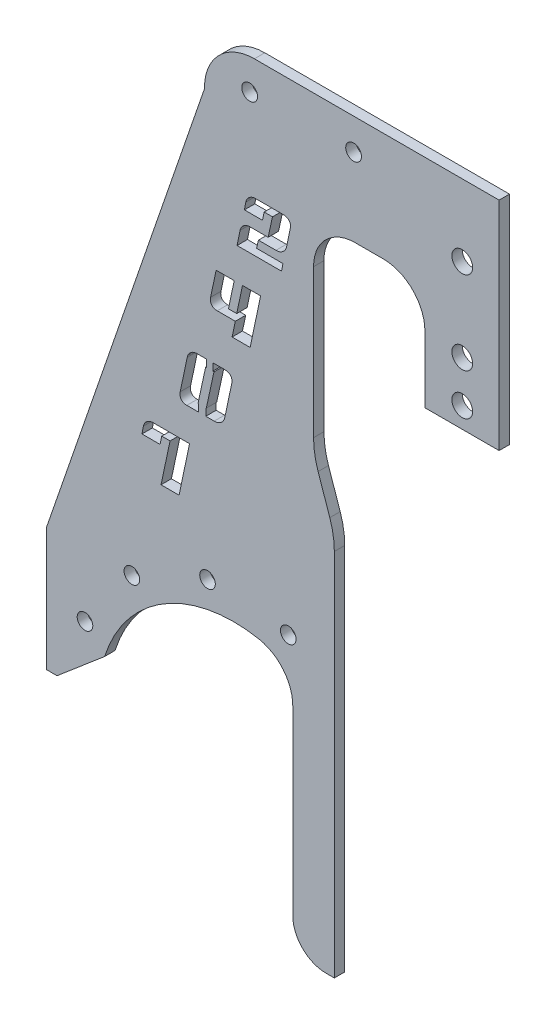
from build123d import *

# Parameters (mm, degrees)
BOSS_EXTRUDE1_DEPTH  = 6.35
FILLET1_R            = 8.255
SKETCH2_R            = 3.175
CUT_EXTRUDE1_DEPTH   = 128.158650905
CHAMFER2_START       = -126.7457463
CHAMFER2_OUTLINE_W   = 36
CHAMFER2_OUTLINE_H   = 6.35
CHAMFER2_DEPTH       = 83.771913248
FILLET4_R            = 20.955
FILLET5_R            = 12.7
SKETCH3_W            = 25.4
SKETCH3_H            = 25.4
SKETCH3_R            = 3.175
BOSS_EXTRUDE2_DEPTH  = 6.35
SKETCH4_W            = 25.4
SKETCH4_H            = 177.8
SKETCH4_R            = 3.175
BOSS_EXTRUDE3_DEPTH  = 6.35
SKETCH5_W            = 25.4
SKETCH5_H            = 101.6
CUT_EXTRUDE2_DEPTH   = 144.824345992
CHAMFER3_DEPTH       = 6.35
FILLET7_R            = 22.86
SKETCH6_R            = 2.38125
CUT_EXTRUDE3_DEPTH   = 144.824345992
BOSS_EXTRUDE4_DEPTH  = 6.35
SKETCH8_W            = 135.766472114
SKETCH8_H            = 151.024358954
CUT_EXTRUDE4_DEPTH   = 144.824345992
CHAMFER4_SIZE        = 48.26
CHAMFER4_SIZE2       = 140.157216957
FILLET8_R            = 12.7
SKETCH9_W            = 6.35
SKETCH9_H            = 40.340536446
BOSS_EXTRUDE5_DEPTH  = 6.35
FILLET9_R            = 12.7
FILLET10_R           = 12.7
SKETCH10_W           = 12.7
SKETCH10_H           = 17.865875077
CUT_EXTRUDE5_DEPTH   = 144.824345992
CUT_EXTRUDE6_DEPTH   = 144.824345992
FILLET11_R           = 12.7
CUT_EXTRUDE7_DEPTH   = 144.824345992
SKETCH13_W           = 91.44
SKETCH13_H           = 15.550301769
BOSS_EXTRUDE6_DEPTH  = 6.35
FILLET12_R           = 15.24
SKETCH14_W           = 6.35
SKETCH14_H           = 101.6
BOSS_EXTRUDE7_DEPTH  = 6.35
CHAMFER5_SIZE        = 7.62
CHAMFER5_SIZE_2      = 22.130086888
FILLET13_R           = 25.4
FILLET14_R           = 12.7
CUT_EXTRUDE8_DEPTH   = 156.200115028
SKETCH16_W           = 1.995675916
SKETCH16_H           = 3.389683485
SKETCH16_W_2         = 2.247396164
SKETCH16_H_2         = 3.571492208
BOSS_EXTRUDE9_DEPTH  = 6.35
SKETCH18_W           = 15.365544209
SKETCH18_H           = 72.075093694
SKETCH18_W_2         = 16.922999919
SKETCH18_H_2         = 33.02
CUT_EXTRUDE9_DEPTH   = 156.200115173
FILLET15_R           = 12.7
SKETCH19_W           = 12.7
SKETCH19_H           = 50.8
BOSS_EXTRUDE10_DEPTH = 6.35
FILLET16_R           = 10.16
SKETCH20_R           = 244.077195531
CUT_EXTRUDE10_DEPTH  = 3.175
SKETCH21_R           = 2.413
CUT_EXTRUDE11_DEPTH  = 156.102655922


with BuildPart() as part:
    # Sketch1 → Boss-Extrude1 (new body)
    with BuildSketch(Plane.XY):
        with BuildLine():
            Line((12.7, 76.2), (-12.7, 76.2))
            Line((-12.7, 76.2), (-12.7, -28.680951188))
            ThreePointArc((-12.7, -28.680951188), (-71.390768363, -25.798437524), (-101.6, -76.2))
            Line((-101.6, -76.2), (-85.725, -76.2))
            ThreePointArc((-85.725, -76.2), (-58.470420375, -37.379213847), (-12.7, -49.826469235))
            Line((-12.7, -49.826469235), (-12.7, -76.2))
            Line((-12.7, -76.2), (12.7, -76.2))
            Line((12.7, -76.2), (12.7, 76.2))
        make_face()
    extrude(amount=BOSS_EXTRUDE1_DEPTH)

    # Fillet1
    fillet1_edges = [part.edges().sort_by_distance(p)[0] for p in [
        (-12.7, -49.826469235, 3.175),
    ]]
    fillet(fillet1_edges, radius=FILLET1_R)

    # Chamfer1
    # the kernel refuses this chamfer: 16.925734726, 15.24 mm, written as the material it takes off along each edge
    with BuildSketch(Plane(origin=(-85.725, -76.2, -32.922584323), x_dir=(0.15149402541241913, 0.9884581732498049, 0), z_dir=(0, 0, 1))) as chamfer1_piece_1:
        with BuildLine():
            Line((13.017434015, -0.44343203), (-2.4273823, 12.943386903))
            Line((-2.4273823, 12.943386903), (-2.761989917, 12.89210395))
            ThreePointArc((-2.761989917, 12.89210395), (-1.331569383, 6.453627085), (-0.334607617, -0.051282954))
            Line((-0.334607617, -0.051282954), (0.051282954, -0.334607617))
            ThreePointArc((0.051282954, -0.334607617), (6.510978775, 0.137060785), (12.966151061, -0.778039646))
            Line((12.966151061, -0.778039646), (13.017434015, -0.44343203))
        make_face()
    extrude(amount=72.195168646, mode=Mode.SUBTRACT)

    # Sketch2 → Cut-Extrude1 (cut, through all)
    with BuildSketch(Plane.XY.offset(6.35)):
        with Locations((0, 57.15)):
            Circle(SKETCH2_R)
        with Locations((0, 69.85)):
            Circle(SKETCH2_R)
    extrude(amount=-CUT_EXTRUDE1_DEPTH, mode=Mode.SUBTRACT)

    # Chamfer2: read off the stored shape, not the designer's step
    # Chamfer2 outline → Chamfer2 (cut)
    with BuildSketch(Plane(origin=(0, 0, 0), x_dir=(0.6493951635681026, -0.7604511302735748, 0), z_dir=(0.7604511302735747, 0.6493951635681027, 0)).offset(CHAMFER2_START)):
        with Locations((47, -3.175)):
            Rectangle(CHAMFER2_OUTLINE_W, CHAMFER2_OUTLINE_H)
    extrude(amount=CHAMFER2_DEPTH, mode=Mode.SUBTRACT)

    # Fillet4
    # the kernel refuses this fillet: 20.955 mm, written as the material it takes off along each edge
    with BuildSketch(Plane(origin=(8.560811014, -76.2, 27.244649936), x_dir=(1, 0, 0), z_dir=(0, 0, -1))) as fillet4_piece_1:
        with BuildLine():
            CenterArc((10.50769959, -19.963819717), FILLET4_R, 107.692818626, 31.811166067)
            Line((-5.427553845, -6.355744064), (-5.746258914, -6.083582551))
            Line((-5.746258914, -6.083582551), (-0.318705069, 0.272161513))
            Line((-0.318705069, 0.272161513), (0, 0.4191))
            ThreePointArc((0, 0.4191), (2.069594493, 0.4191), (4.011818774, 0.399276394))
            Line((4.011818774, 0.399276394), (4.139188986, 0))
        make_face()
    extrude(amount=48.139299873, mode=Mode.SUBTRACT)

    # Fillet5
    fillet5_edges = [part.edges().sort_by_distance(p)[0] for p in [
        (-12.7, -28.680951188, 3.175),
    ]]
    fillet(fillet5_edges, radius=FILLET5_R)

    # Sketch3 → Boss-Extrude2 (add)
    with BuildSketch(Plane.XY.offset(6.35)):
        with Locations((0, 88.9)):
            Rectangle(SKETCH3_W, SKETCH3_H)
        with Locations((0, 95.25)):
            Circle(SKETCH3_R, mode=Mode.SUBTRACT)
    extrude(amount=-BOSS_EXTRUDE2_DEPTH)

    # Sketch4 → Boss-Extrude3 (add)
    with BuildSketch(Plane(origin=(0, 0, 0), x_dir=(-1, 0, 0), z_dir=(0, 0, -1))):
        with Locations((-25.4, 12.7)):
            Rectangle(SKETCH4_W, SKETCH4_H)
        with Locations((-25.4, 95.25)):
            Circle(SKETCH4_R, mode=Mode.SUBTRACT)
        with Locations((-25.4, 69.85)):
            Circle(SKETCH4_R, mode=Mode.SUBTRACT)
        with Locations((-25.4, 57.15)):
            Circle(SKETCH4_R, mode=Mode.SUBTRACT)
    extrude(amount=-BOSS_EXTRUDE3_DEPTH)

    # Sketch5 → Cut-Extrude2 (cut, through all)
    with BuildSketch(Plane(origin=(0, 0, 0), x_dir=(-1, 0, 0), z_dir=(0, 0, -1))):
        with Locations((0, 50.8)):
            Rectangle(SKETCH5_W, SKETCH5_H)
    extrude(amount=-CUT_EXTRUDE2_DEPTH, mode=Mode.SUBTRACT)

    # Chamfer3: read off the stored shape, not the designer's step
    # Chamfer3 outline → Chamfer3 (cut)
    with BuildSketch(Plane.XY):
        with BuildLine():
            ThreePointArc((-12.7, -8.997916699), (-13.235467867, -12.646773779), (-14.796717794, -15.98793862))
            Line((-14.796717794, -15.98793862), (12.7, -1.180669249))
            Line((12.7, -1.180669249), (12.7, 0))
            Line((12.7, 0), (-12.7, 0))
            Line((-12.7, 0), (-12.7, -8.997916699))
        make_face()
    extrude(amount=CHAMFER3_DEPTH, mode=Mode.SUBTRACT)

    # Fillet7
    fillet7_edges = [part.edges().sort_by_distance(p)[0] for p in [
        (-14.796717794, -15.98793862, 3.175),
        (12.7, -1.180669249, 3.175),
    ]]
    fillet(fillet7_edges, radius=FILLET7_R)

    # Sketch6 → Cut-Extrude3 (cut, through all)
    with BuildSketch(Plane(origin=(0, 0, 0), x_dir=(-1, 0, 0), z_dir=(0, 0, -1))):
        with Locations((89.842397197, -57.554736727)):
            Circle(SKETCH6_R)
        with Locations((75.517874882, -38.214440689)):
            Circle(SKETCH6_R)
        with Locations((52.406792333, -27.776813182)):
            Circle(SKETCH6_R)
        with Locations((27.741530006, -30.059534069)):
            Circle(SKETCH6_R)
    extrude(amount=-CUT_EXTRUDE3_DEPTH, mode=Mode.SUBTRACT)

    # Sketch7 → Boss-Extrude4 (add)
    with BuildSketch(Plane(origin=(0, 0, 0), x_dir=(-1, 0, 0), z_dir=(0, 0, -1))):
        with BuildLine():
            Line((-12.7, 101.6), (-12.7, 50.876119176))
            Line((-12.7, 50.876119176), (20.01821952, 50.876119176))
            Line((20.01821952, 50.876119176), (20.01821952, -20.501239648))
            ThreePointArc((20.01821952, -20.501239648), (24.376422726, -21.656601053), (28.863636364, -21.216477299))
            ThreePointArc((28.863636364, -21.216477299), (78.912746685, -30.610071387), (101.6, -76.2))
            Line((101.6, -76.2), (101.6, 101.6))
            Line((101.6, 101.6), (-12.7, 101.6))
        make_face()
    extrude(amount=-BOSS_EXTRUDE4_DEPTH)

    # Sketch8 → Cut-Extrude4 (cut, through all)
    with BuildSketch(Plane(origin=(0, 0, 0), x_dir=(-1, 0, 0), z_dir=(0, 0, -1))):
        with Locations((-47.865016537, -24.636060301)):
            Rectangle(SKETCH8_W, SKETCH8_H)
    extrude(amount=-CUT_EXTRUDE4_DEPTH, mode=Mode.SUBTRACT)

    # Chamfer4
    chamfer4_edges = [part.edges().sort_by_distance(p)[0] for p in [
        (-101.6, 101.6, 3.175),
    ]]
    chamfer4_side = [part.faces().sort_by_distance(p)[0] for p in [
        (-31.75, 101.6, 3.175),
    ]]
    chamfer(chamfer4_edges, length=CHAMFER4_SIZE, length2=CHAMFER4_SIZE2, reference=chamfer4_side[0])

    # Fillet8
    fillet8_edges = [part.edges().sort_by_distance(p)[0] for p in [
        (-20.01821952, 50.876119176, 3.175),
    ]]
    fillet(fillet8_edges, radius=FILLET8_R)

    # Sketch9 → Boss-Extrude5 (add)
    with BuildSketch(Plane(origin=(0, 0, 0), x_dir=(-1, 0, 0), z_dir=(0, 0, -1))):
        with Locations((23.19321952, -56.029731777)):
            Rectangle(SKETCH9_W, SKETCH9_H)
    extrude(amount=-BOSS_EXTRUDE5_DEPTH)

    # Fillet9
    fillet9_edges = [part.edges().sort_by_distance(p)[0] for p in [
        (-26.36821952, -39.096430904, 3.175),
    ]]
    fillet(fillet9_edges, radius=FILLET9_R)

    # Fillet10
    # the kernel refuses this fillet: 12.7 mm, written as the material it takes off along each edge
    with BuildSketch(Plane(origin=(-26.36821952, -76.2, -27.49630657), x_dir=(0, 1, 0), z_dir=(0, 0, 1))) as fillet10_piece_1:
        with BuildLine():
            CenterArc((10.998522628, -12.7), FILLET10_R, 90, 60)
            Line((0, -6.35), (-0.219970453, -6.223))
            ThreePointArc((-0.219970453, -6.223), (-0.254, -3.175), (-0.254, 0))
            Line((-0.254, 0), (0, 0.254))
            Line((0, 0.254), (10.998522628, 0.254))
            Line((10.998522628, 0.254), (10.998522628, 0))
        make_face()
    extrude(amount=61.34261314, mode=Mode.SUBTRACT)

    # Sketch10 → Cut-Extrude5 (cut, through all)
    with BuildSketch(Plane(origin=(0, 0, 0), x_dir=(-1, 0, 0), z_dir=(0, 0, -1))):
        with Locations((0, 59.809056715)):
            Rectangle(SKETCH10_W, SKETCH10_H)
    extrude(amount=-CUT_EXTRUDE5_DEPTH, mode=Mode.SUBTRACT)

    # Sketch11 → Cut-Extrude6 (cut, through all)
    with BuildSketch(Plane(origin=(0, 0, 0), x_dir=(-1, 0, 0), z_dir=(0, 0, -1))):
        Polygon((-12.7, 76.276119176), (-12.7, 50.876119176), (-6.35, 50.876119176), (-6.35, 68.741994253), (6.35, 68.741994253), (6.35, 50.876119176), (7.31821952, 50.876119176), (12.7, 50.876119176), (12.7, 76.276119176), align=None)
        with BuildLine():
            Line((-6.35, 50.876119176), (-12.7, 50.876119176))
            Line((-12.7, 50.876119176), (-12.7, 33.21835148))
            Line((-12.7, 33.21835148), (12.7, 33.21835148))
            Line((12.7, 33.21835148), (12.7, 49.679442125))
            ThreePointArc((12.7, 49.679442125), (10.074829626, 50.573340669), (7.31821952, 50.876119176))
            Line((7.31821952, 50.876119176), (6.35, 50.876119176))
            Line((6.35, 50.876119176), (-6.35, 50.876119176))
        make_face()
        with BuildLine():
            Line((12.7, 50.876119176), (7.31821952, 50.876119176))
            ThreePointArc((7.31821952, 50.876119176), (10.074829626, 50.573340669), (12.7, 49.679442125))
            Line((12.7, 49.679442125), (12.7, 50.876119176))
        make_face()
    extrude(amount=-CUT_EXTRUDE6_DEPTH, mode=Mode.SUBTRACT)

    # Fillet11
    fillet11_edges = [part.edges().sort_by_distance(p)[0] for p in [
        (-12.7, 49.679442125, 3.175),
    ]]
    fillet(fillet11_edges, radius=FILLET11_R)

    # Sketch12 → Cut-Extrude7 (cut, through all)
    with BuildSketch(Plane(origin=(0, 0, 0), x_dir=(-1, 0, 0), z_dir=(0, 0, -1))):
        Polygon((-12.7, 83.896119176), (-12.7, 76.276119176), (12.7, 76.276119176), (20.01821952, 76.276119176), (20.01821952, 83.896119176), align=None)
        with BuildLine():
            ThreePointArc((16.35910976, 47.095328988), (19.067885602, 42.99642487), (20.01821952, 38.176119176))
            Line((20.01821952, 38.176119176), (20.01821952, 76.276119176))
            Line((20.01821952, 76.276119176), (12.7, 76.276119176))
            Line((12.7, 76.276119176), (12.7, 56.014538801))
            ThreePointArc((12.7, 56.014538801), (13.650333919, 51.194233107), (16.35910976, 47.095328988))
        make_face()
    extrude(amount=-CUT_EXTRUDE7_DEPTH, mode=Mode.SUBTRACT)

    # Sketch13 → Boss-Extrude6 (add)
    with BuildSketch(Plane(origin=(0, 0, 0), x_dir=(-1, 0, 0), z_dir=(0, 0, -1))):
        with Locations((7.62, 109.375150885)):
            Rectangle(SKETCH13_W, SKETCH13_H)
    extrude(amount=-BOSS_EXTRUDE6_DEPTH)

    # Fillet12
    fillet12_edges = [part.edges().sort_by_distance(p)[0] for p in [
        (-53.34, 117.150301769, 3.175),
    ]]
    fillet(fillet12_edges, radius=FILLET12_R)

    # Sketch14 → Boss-Extrude7 (add)
    with BuildSketch(Plane(origin=(0, 0, 0), x_dir=(-1, 0, 0), z_dir=(0, 0, -1))):
        with Locations((16.84321952, -25.4)):
            Rectangle(SKETCH14_W, SKETCH14_H)
    extrude(amount=-BOSS_EXTRUDE7_DEPTH)

    # Chamfer5
    # the kernel refuses this chamfer: 22.130086888, 7.62 mm, written as the material it takes off along each edge
    with BuildSketch(Plane(origin=(-13.66821952, 25.4, -57.422178241), x_dir=(-1, 0, 0), z_dir=(0, 0, 1))) as chamfer5_piece_1_section:
        Polygon((CHAMFER5_SIZE, 0), (0, CHAMFER5_SIZE_2), (0, 0), align=None)
    chamfer5_piece_1 = extrude(amount=121.194356483, mode=Mode.PRIVATE)
    chamfer5_piece_1 = split(chamfer5_piece_1, bisect_by=Plane(origin=(-20.01821952, 25.4, -57.422178241), z_dir=(1, 0, 0)), keep=Keep.TOP, mode=Mode.PRIVATE)
    add(chamfer5_piece_1, mode=Mode.SUBTRACT)

    # Fillet13
    fillet13_edges = [part.edges().sort_by_distance(p)[0] for p in [
        (-13.66821952, 3.269913112, 3.175),
        (-20.01821952, 21.711652185, 3.175),
    ]]
    fillet(fillet13_edges, radius=FILLET13_R)

    # Fillet14
    fillet14_edges = [part.edges().sort_by_distance(p)[0] for p in [
        (12.7, 83.896119176, 3.175),
        (-20.01821952, 83.896119176, 3.175),
    ]]
    fillet(fillet14_edges, radius=FILLET14_R)

    # Sketch15 → Cut-Extrude8 (cut, through all)
    # profile 1 of 4: a face of its own
    with BuildSketch(Plane(origin=(0, 0, 0), x_dir=(-1, 0, 0), z_dir=(0, 0, -1))):
        with BuildLine():
            Line((37.423336541, 67.350356189), (29.368361541, 67.350356189))
            Line((29.368361541, 67.350356189), (29.803336541, 65.115156189))
            Line((29.803336541, 65.115156189), (43.376461541, 65.115156189))
            Line((43.376461541, 65.115156189), (42.487461541, 69.537931189))
            add(Edge.make_bspline(
                [(42.487461541, 69.537931189), (42.439491304, 69.717846382), (42.345576203, 70.070080495), (42.104848531, 70.554472675), (41.796093145, 70.985703113), (41.478034157, 71.291922797), (41.195147902, 71.501181375), (40.975393674, 71.643936494), (40.743734122, 71.760257114), (40.504249646, 71.855301117), (40.258554457, 71.933214474), (40.003328091, 71.986562606), (39.738782449, 72.019396235), (39.559150612, 72.022421629), (39.468036541, 72.023956189)],
                knots=[0, 0, 0, 0, 1.578394199, 3.090146365, 4.564767424, 6.065223583, 6.816797075, 7.552502711, 8.288263273, 9.01445984, 9.739542608, 10.474808689, 11.22638218, 12, 12, 12, 12], degree=3))
            Line((39.468036541, 72.023956189), (33.902261541, 72.023956189))
            Line((33.902261541, 72.023956189), (32.562411541, 78.119956189))
            Line((32.562411541, 78.119956189), (35.102411541, 78.119956189))
            Line((35.102411541, 78.119956189), (35.619936541, 75.662506189))
            Line((35.619936541, 75.662506189), (41.134911541, 75.662506189))
            Line((41.134911541, 75.662506189), (40.722161541, 77.910406189))
            add(Edge.make_bspline(
                [(40.722161541, 77.910406189), (40.674491653, 78.088389766), (40.581031259, 78.437339935), (40.335597763, 78.913567242), (40.027769829, 79.339916769), (39.645754432, 79.698040544), (39.214207552, 79.993186866), (38.739807574, 80.203594228), (38.230285895, 80.333203675), (37.879199682, 80.347725761), (37.699561541, 80.355156189)],
                knots=[0, 0, 0, 0, 1.047778653, 2.054248732, 3.034163218, 4.032826441, 5.023511064, 6.001249839, 6.977311692, 8, 8, 8, 8], degree=3))
            Line((37.699561541, 80.355156189), (29.342961541, 80.355156189))
            add(Edge.make_bspline(
                [(29.342961541, 80.355156189), (29.238131631, 80.352251771), (29.035390122, 80.346634615), (28.741617675, 80.3167973), (28.470808847, 80.258767219), (28.220341853, 80.18121603), (27.995078052, 80.074280042), (27.787949913, 79.952381373), (27.609180841, 79.799065383), (27.450582912, 79.629188213), (27.317146, 79.440694938), (27.208252046, 79.240722068), (27.127702705, 79.026942133), (27.074649459, 78.801731166), (27.04591104, 78.565291018), (27.043952689, 78.317465445), (27.064606075, 78.057524774), (27.101537134, 77.882578219), (27.120461541, 77.792931189)],
                knots=[0, 0, 0, 0, 1.249937443, 2.417384547, 3.513467933, 4.546771143, 5.534480391, 6.479957665, 7.402258788, 8.330665369, 9.244298056, 10.147418799, 11.037761399, 11.958767457, 12.899181447, 13.870644368, 14.908864439, 16, 16, 16, 16], degree=3))
            Line((27.120461541, 77.792931189), (28.282511541, 72.258906189))
            add(Edge.make_bspline(
                [(28.282511541, 72.258906189), (28.329460787, 72.089484378), (28.422658288, 71.753170371), (28.668826014, 71.286748605), (28.99100219, 70.862815202), (29.318726073, 70.550708675), (29.613995767, 70.332164807), (29.847936348, 70.184055412), (30.097892511, 70.065655923), (30.354300173, 69.96133852), (30.62535284, 69.886584169), (30.90607946, 69.828003227), (31.199683695, 69.79763349), (31.398189024, 69.791741899), (31.498786541, 69.788756189)],
                knots=[0, 0, 0, 0, 1.439879864, 2.858261076, 4.297092, 5.796605761, 6.554250161, 7.311296499, 8.065145161, 8.821842411, 9.580880455, 10.369812676, 11.173862002, 12, 12, 12, 12], degree=3))
            Line((31.498786541, 69.788756189), (36.867711541, 69.788756189))
            Line((36.867711541, 69.788756189), (37.423336541, 67.350356189))
        make_face()
    # profile 2 of 4: a face of its own
    with BuildSketch(Plane(origin=(0, 0, 0), x_dir=(-1, 0, 0), z_dir=(0, 0, -1))):
        with BuildLine():
            Line((44.252761541, 55.377556189), (46.021236541, 47.046356189))
            Line((46.021236541, 47.046356189), (43.490761541, 47.046356189))
            Line((43.490761541, 47.046356189), (41.722286541, 55.377556189))
            Line((41.722286541, 55.377556189), (36.197786541, 55.377556189))
            Line((36.197786541, 55.377556189), (39.391836541, 40.137556189))
            Line((39.391836541, 40.137556189), (44.906811541, 40.137556189))
            Line((44.906811541, 40.137556189), (43.916211541, 44.811156189))
            Line((43.916211541, 44.811156189), (49.440711541, 44.811156189))
            add(Edge.make_bspline(
                [(49.440711541, 44.811156189), (49.533988376, 44.812279248), (49.715959963, 44.814470199), (49.978050317, 44.851704771), (50.223707815, 44.903575808), (50.447942287, 44.983462626), (50.654739976, 45.083051933), (50.844439326, 45.203339006), (51.011915819, 45.351187661), (51.162673757, 45.516236813), (51.288907325, 45.70039241), (51.392308055, 45.899459895), (51.46780243, 46.112348459), (51.518265002, 46.338376608), (51.548571172, 46.577702542), (51.545156948, 46.830918629), (51.524517817, 47.09776253), (51.490374344, 47.277319399), (51.472711541, 47.370206189)],
                knots=[0, 0, 0, 0, 1.156861888, 2.256894677, 3.280098194, 4.269072268, 5.203386789, 6.12542674, 7.047466691, 7.96838266, 8.894066129, 9.810754889, 10.745808144, 11.689223793, 12.681682635, 13.732764659, 14.827133627, 16, 16, 16, 16], degree=3))
            Line((51.472711541, 47.370206189), (49.780436541, 55.377556189))
            Line((49.780436541, 55.377556189), (44.252761541, 55.377556189))
        make_face()
    # profile 3 of 4: a face of its own
    with BuildSketch(Plane(origin=(0, 0, 0), x_dir=(-1, 0, 0), z_dir=(0, 0, -1))):
        with BuildLine():
            add(Edge.make_bspline(
                [(47.154711541, 17.636456189), (47.201484314, 17.465901734), (47.294067879, 17.128300644), (47.541988684, 16.660735149), (47.862268156, 16.234517307), (48.190830036, 15.920320338), (48.488965869, 15.704223366), (48.722614872, 15.556041295), (48.970786628, 15.436136076), (49.227416185, 15.331954982), (49.498848516, 15.258769637), (49.779238194, 15.198749164), (50.071903185, 15.168924179), (50.27039558, 15.162972401), (50.370986541, 15.159956189)],
                knots=[0, 0, 0, 0, 1.44644749, 2.863145689, 4.307196154, 5.804930633, 6.568659922, 7.324807969, 8.06997023, 8.825769603, 9.592254981, 10.371747012, 11.174842275, 12, 12, 12, 12], degree=3))
            Line((50.370986541, 15.159956189), (58.727586541, 15.159956189))
            add(Edge.make_bspline(
                [(58.727586541, 15.159956189), (58.820777412, 15.162883439), (59.00135834, 15.168555728), (59.263618794, 15.198267644), (59.505327306, 15.25725437), (59.731448873, 15.332002072), (59.936493424, 15.434062668), (60.125382794, 15.55620271), (60.292562001, 15.703058196), (60.442963769, 15.868329148), (60.570790723, 16.05277978), (60.670295711, 16.253936585), (60.753796502, 16.465256595), (60.801085769, 16.692738862), (60.832488118, 16.93278338), (60.828795115, 17.186088341), (60.808234855, 17.452907099), (60.774080153, 17.632467547), (60.756411541, 17.725356189)],
                knots=[0, 0, 0, 0, 1.157721944, 2.243379635, 3.269830871, 4.242365612, 5.194529467, 6.10581743, 7.02812659, 7.949311439, 8.875265181, 9.803919724, 10.731457647, 11.687965172, 12.680713783, 13.732102692, 14.826791184, 16, 16, 16, 16], degree=3))
            Line((60.756411541, 17.725356189), (58.603761541, 27.917106189))
            add(Edge.make_bspline(
                [(58.603761541, 27.917106189), (58.555716988, 28.096970827), (58.461656391, 28.449105965), (58.221698915, 28.934771725), (57.909016316, 29.363170635), (57.530956245, 29.730889814), (57.099901285, 30.031663885), (56.62387679, 30.245431335), (56.113288043, 30.378497243), (55.760838972, 30.392710377), (55.581161541, 30.399956189)],
                knots=[0, 0, 0, 0, 1.052270567, 2.060112784, 3.046720482, 4.042731471, 5.033589851, 6.00727884, 6.984116999, 8, 8, 8, 8], degree=3))
            Line((55.581161541, 30.399956189), (47.224561541, 30.399956189))
            add(Edge.make_bspline(
                [(47.224561541, 30.399956189), (47.119718469, 30.397088521), (46.916951505, 30.391542438), (46.623356714, 30.361209078), (46.351610818, 30.304827381), (46.104289992, 30.221673216), (45.877280996, 30.119762319), (45.673753991, 29.993330312), (45.493783187, 29.840971889), (45.335446, 29.670721689), (45.201743066, 29.482406609), (45.09299042, 29.280888987), (45.009650624, 29.067861864), (44.955636689, 28.841328832), (44.927742047, 28.604769768), (44.925488316, 28.355922198), (44.946223596, 28.095972936), (44.98314307, 27.921027596), (45.002061541, 27.831381189)],
                knots=[0, 0, 0, 0, 1.249128335, 2.415819727, 3.511193598, 4.547745403, 5.518088207, 6.469574759, 7.391278859, 8.319084465, 9.232125739, 10.134661875, 11.040713258, 11.948867257, 12.901188666, 13.872022741, 14.909570752, 16, 16, 16, 16], degree=3))
            Line((45.002061541, 27.831381189), (47.154711541, 17.636456189))
        make_face()
        Polygon((52.984011541, 28.164756189), (55.304936541, 17.395156189), (52.774461541, 17.395156189), (50.444011541, 28.164756189), align=None, mode=Mode.SUBTRACT)
    # profile 4 of 4: a face of its own
    with BuildSketch(Plane(origin=(0, 0, 0), x_dir=(-1, 0, 0), z_dir=(0, 0, -1))):
        with BuildLine():
            Line((61.096136541, -9.801768811), (66.611111541, -9.801768811))
            Line((66.611111541, -9.801768811), (63.855211541, 3.187156189))
            Line((63.855211541, 3.187156189), (66.395211541, 3.187156189))
            Line((66.395211541, 3.187156189), (66.912736541, 0.729706189))
            Line((66.912736541, 0.729706189), (72.427711541, 0.729706189))
            Line((72.427711541, 0.729706189), (72.014961541, 2.977606189))
            add(Edge.make_bspline(
                [(72.014961541, 2.977606189), (71.967291653, 3.155589766), (71.873831259, 3.504539935), (71.628397763, 3.980767242), (71.320569829, 4.407116769), (70.938554432, 4.765240544), (70.507007552, 5.060386866), (70.032607574, 5.270794228), (69.523085895, 5.400403675), (69.171999682, 5.414925761), (68.992361541, 5.422356189)],
                knots=[0, 0, 0, 0, 1.047778653, 2.054248732, 3.034163218, 4.032826441, 5.023511064, 6.001249839, 6.977311692, 8, 8, 8, 8], degree=3))
            Line((68.992361541, 5.422356189), (57.905261541, 5.422356189))
            Line((57.905261541, 5.422356189), (61.096136541, -9.801768811))
        make_face()
    extrude(amount=-CUT_EXTRUDE8_DEPTH, mode=Mode.SUBTRACT)


with BuildPart() as cut_extrude8_piece_1:
    # of the separate pieces the step leaves, piece 1, a body of its own (cut_extrude8_pieces)
    add(part.part.solids().sort_by_distance((-20.01821952, 71.196119176, 0))[0])



with BuildPart() as cut_extrude8_piece_2:
    # of the separate pieces the step leaves, piece 2, a body of its own (cut_extrude8_pieces)
    add(part.part.solids().sort_by_distance((-50.444011541, 28.164756189, 0))[0])


with BuildPart() as cut_extrude8_piece_1_1:
    add(cut_extrude8_piece_1.part)

    add(cut_extrude8_piece_2.part)  # Boss-Extrude9 merges Cut-Extrude8 piece 2
    # Sketch16 → Boss-Extrude9 (add)
    with BuildSketch(Plane(origin=(0, 0, 0), x_dir=(-1, 0, 0), z_dir=(0, 0, -1))):
        with Locations((51.797694681, 28.778645085)):
            Rectangle(SKETCH16_W, SKETCH16_H)
        with Locations((54.064254892, 16.052384495)):
            Rectangle(SKETCH16_W_2, SKETCH16_H_2)
    extrude(amount=-BOSS_EXTRUDE9_DEPTH)

    # Sketch18 → Cut-Extrude9 (cut, through all)
    with BuildSketch(Plane(origin=(0, 0, 0), x_dir=(-1, 0, 0), z_dir=(0, 0, -1))):
        with Locations((-44.349935949, 86.913666023)):
            Rectangle(SKETCH18_W, SKETCH18_H)
        with Locations((-5.531136474, 67.386119176)):
            Rectangle(SKETCH18_W_2, SKETCH18_H_2)
    extrude(amount=-CUT_EXTRUDE9_DEPTH, mode=Mode.SUBTRACT)

    # Fillet15
    fillet15_edges = [cut_extrude8_piece_1_1.edges().sort_by_distance(p)[0] for p in [
        (13.992636433, 83.896119176, 3.175),
    ]]
    fillet(fillet15_edges, radius=FILLET15_R)

    # Sketch19 → Boss-Extrude10 (add)
    with BuildSketch(Plane(origin=(0, 0, 0), x_dir=(-1, 0, 0), z_dir=(0, 0, -1))):
        with Locations((20.01821952, -88.411145758)):
            Rectangle(SKETCH19_W, SKETCH19_H)
    extrude(amount=-BOSS_EXTRUDE10_DEPTH)

    # Fillet16
    fillet16_edges = [cut_extrude8_piece_1_1.edges().sort_by_distance(p)[0] for p in [
        (-26.36821952, -113.811145758, 3.175),
    ]]
    fillet(fillet16_edges, radius=FILLET16_R)

    # Sketch20 → Cut-Extrude10 (cut)
    with BuildSketch(Plane(origin=(0, 0, 0), x_dir=(-1, 0, 0), z_dir=(0, 0, -1))):
        with Locations((40.870681134, 6.395082628)):
            Circle(SKETCH20_R)
    extrude(amount=-CUT_EXTRUDE10_DEPTH, mode=Mode.SUBTRACT)

    # Sketch21 → Cut-Extrude11 (cut, through all)
    with BuildSketch(Plane(origin=(0, 0, 3.175), x_dir=(-1, 0, 0), z_dir=(0, 0, -1))):
        with Locations((39.532836156, 107.625301769)):
            Circle(SKETCH21_R)
        with Locations((7.782836156, 107.625301769)):
            Circle(SKETCH21_R)
    extrude(amount=-CUT_EXTRUDE11_DEPTH, mode=Mode.SUBTRACT)


solid = cut_extrude8_piece_1_1.part
